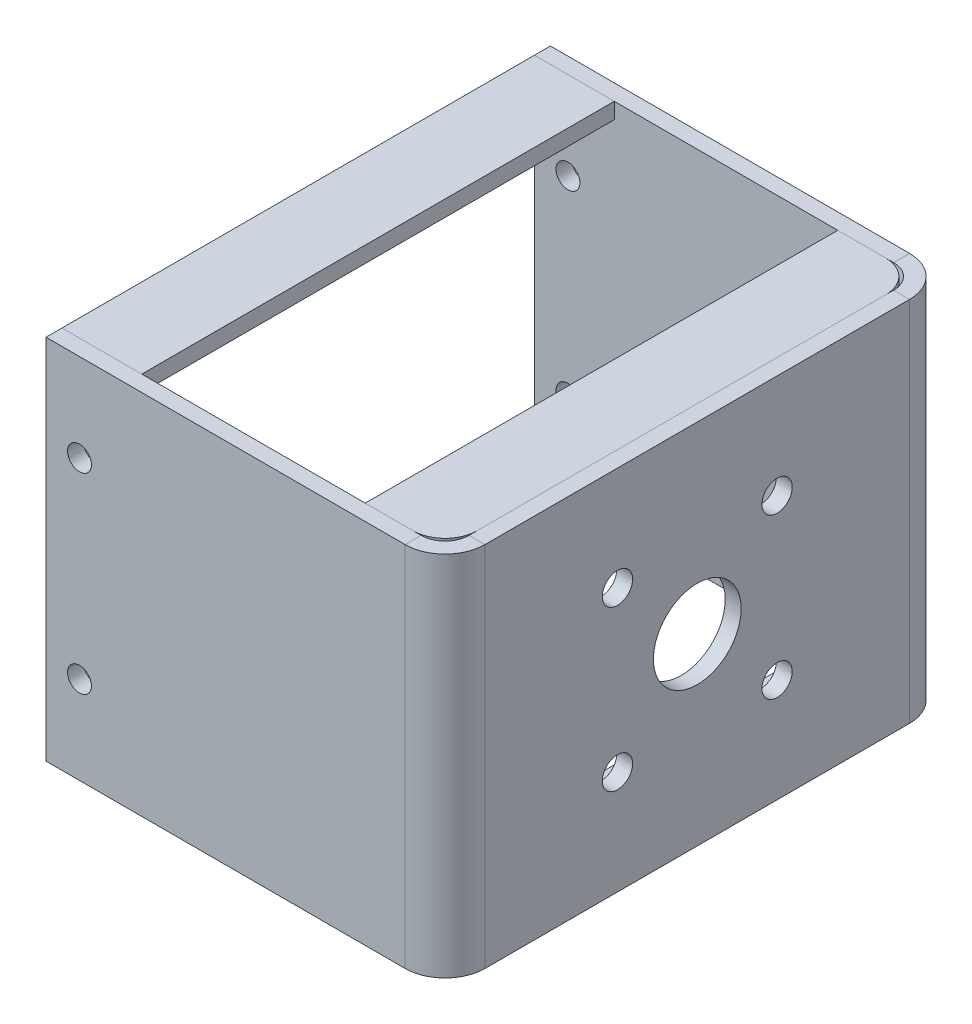
from build123d import *

# Parameters (mm, degrees)
SKETCH1_W                      = 316
SKETCH1_H                      = 230
BASE_FLANGE1_DEPTH             = 10
EDGE_FLANGE1_STRIP_W           = 70
EDGE_FLANGE1_STRIP_H           = 10
EDGE_FLANGE1_STRIP_CUT_DEPTH   = 230
EDGE_FLANGE1_STRIP_2_W         = 70
EDGE_FLANGE1_STRIP_2_H         = 10
EDGE_FLANGE1_STRIP_CUT_2_DEPTH = 230
EDGE_FLANGE1_DEPTH             = 230
EDGE_FLANGE1_BEND_DEPTH        = 230
SKETCH12_R                     = 27.5
CUT_EXTRUDE1_DEPTH             = 10
SKETCH13_R                     = 7.5
CUT_EXTRUDE2_DEPTH             = 420.023865669
SKETCH14_R                     = 9.5
CUT_EXTRUDE3_DEPTH             = 10
BOSS_EXTRUDE1_DEPTH            = 10
SKETCH15_W                     = 50
SKETCH15_H                     = 296
BOSS_EXTRUDE1_2_DEPTH          = 10
CIRPATTERN1_COUNT              = 4


# Sheet-metal steps are written as plain solids
with BuildPart() as part:
    # Sketch1 → Base-Flange1 (new body)
    with BuildSketch(Plane(origin=(0, 0, 0), x_dir=(0, 0, -1), z_dir=(1, 0, 0))):
        Rectangle(SKETCH1_W, SKETCH1_H)
    extrude(amount=-BASE_FLANGE1_DEPTH)

    # Edge-Flange1 strip (across the edge) → Edge-Flange1 strip cut (cut)
    with BuildSketch(Plane(origin=(-10, -115, 158), x_dir=(0, 0, -1), z_dir=(0, 1, 0))):
        with Locations((-10, -5)):
            Rectangle(EDGE_FLANGE1_STRIP_W, EDGE_FLANGE1_STRIP_H)
    extrude(amount=EDGE_FLANGE1_STRIP_CUT_DEPTH, mode=Mode.SUBTRACT)

    # Edge-Flange1 strip 2 (across the edge) → Edge-Flange1 strip cut 2 (cut)
    with BuildSketch(Plane(origin=(-10, 115, -158), x_dir=(0, 0, 1), z_dir=(0, -1, 0))):
        with Locations((-10, -5)):
            Rectangle(EDGE_FLANGE1_STRIP_2_W, EDGE_FLANGE1_STRIP_2_H)
    extrude(amount=EDGE_FLANGE1_STRIP_CUT_2_DEPTH, mode=Mode.SUBTRACT)

    # Edge-Flange1 section (across the edge) → Edge-Flange1 (add)
    with BuildSketch(Plane(origin=(-10, -115, 158), x_dir=(0, 0, -1), z_dir=(0, 1, 0))):
        with BuildLine():
            Line((0, 15), (0, 240))
            Line((0, 240), (10, 240))
            Line((10, 240), (10, 15))
            ThreePointArc((10, 15), (14.393398282, 4.393398282), (25, 0))
            Line((25, 0), (25, -10))
            ThreePointArc((25, -10), (7.32233047, -2.67766953), (0, 15))
        make_face()
    extrude(amount=EDGE_FLANGE1_DEPTH)

    # Edge-Flange1 section 2 (across the edge) → Edge-Flange1 bend (add)
    with BuildSketch(Plane(origin=(-10, 115, -158), x_dir=(0, 0, 1), z_dir=(0, -1, 0))):
        with BuildLine():
            Line((0, 15), (0, 240))
            Line((0, 240), (10, 240))
            Line((10, 240), (10, 15))
            ThreePointArc((10, 15), (14.393398282, 4.393398282), (25, 0))
            Line((25, 0), (25, -10))
            ThreePointArc((25, -10), (7.32233047, -2.67766953), (0, 15))
        make_face()
    extrude(amount=EDGE_FLANGE1_BEND_DEPTH)

    # Sketch12 → Cut-Extrude1 (cut)
    with BuildSketch(Plane(origin=(0, 0, 0), x_dir=(0, 0, -1), z_dir=(1, 0, 0))):
        Circle(SKETCH12_R)
    extrude(amount=-CUT_EXTRUDE1_DEPTH, mode=Mode.SUBTRACT)

    # Sketch13 → Cut-Extrude2 (cut, through all)
    with BuildSketch(Plane.XY.offset(158)):
        with Locations((-229, 60)):
            Circle(SKETCH13_R)
    cut_extrude2 = extrude(amount=-CUT_EXTRUDE2_DEPTH, mode=Mode.SUBTRACT)

    # Sketch14 → Cut-Extrude3 (cut)
    with BuildSketch(Plane(origin=(0, 0, 0), x_dir=(0, 0, -1), z_dir=(1, 0, 0))):
        with Locations((-50, 50)):
            Circle(SKETCH14_R)
    cut_extrude3 = extrude(amount=-CUT_EXTRUDE3_DEPTH, mode=Mode.SUBTRACT)

    # Mirror1: Cut-Extrude2 across plane
    add(cut_extrude2.mirror(Plane.ZX), mode=Mode.SUBTRACT)

    # CirPattern1: Cut-Extrude3 ×4 about axis
    cirpattern1_axis = Axis((0, 0, 0), (1, 0, 0))
    for i in range(1, CIRPATTERN1_COUNT):
        add(cut_extrude3.rotate(cirpattern1_axis, i * 360 / CIRPATTERN1_COUNT), mode=Mode.SUBTRACT)


with BuildPart() as body_2:
    # Sketch15 → Boss-Extrude1 (new body)
    with BuildSketch(Plane(origin=(0, 115, 0), x_dir=(1, 0, 0), z_dir=(0, 1, 0))):
        with BuildLine():
            Line((-60, 148), (-30, 148))
            ThreePointArc((-30, 148), (-15.857864376, 142.142135624), (-10, 128))
            Line((-10, 128), (-10, -128))
            ThreePointArc((-10, -128), (-15.857864376, -142.142135624), (-30, -148))
            Line((-30, -148), (-60, -148))
            Line((-60, -148), (-60, 148))
        make_face()
    extrude(amount=-BOSS_EXTRUDE1_DEPTH)


with BuildPart() as body_3:
    # Sketch15 → Boss-Extrude1 2 (new body)
    with BuildSketch(Plane(origin=(0, 115, 0), x_dir=(1, 0, 0), z_dir=(0, 1, 0))):
        with Locations((-225, 0)):
            Rectangle(SKETCH15_W, SKETCH15_H)
    extrude(amount=-BOSS_EXTRUDE1_2_DEPTH)


with BuildPart() as body_4:
    # Mirror2: mirrored copy
    add(body_2.part.mirror(Plane.ZX))


with BuildPart() as body_5:
    # Mirror2 2: mirrored copy
    add(body_3.part.mirror(Plane.ZX))


solid = Compound([part.part, body_2.part, body_3.part, body_4.part, body_5.part])
